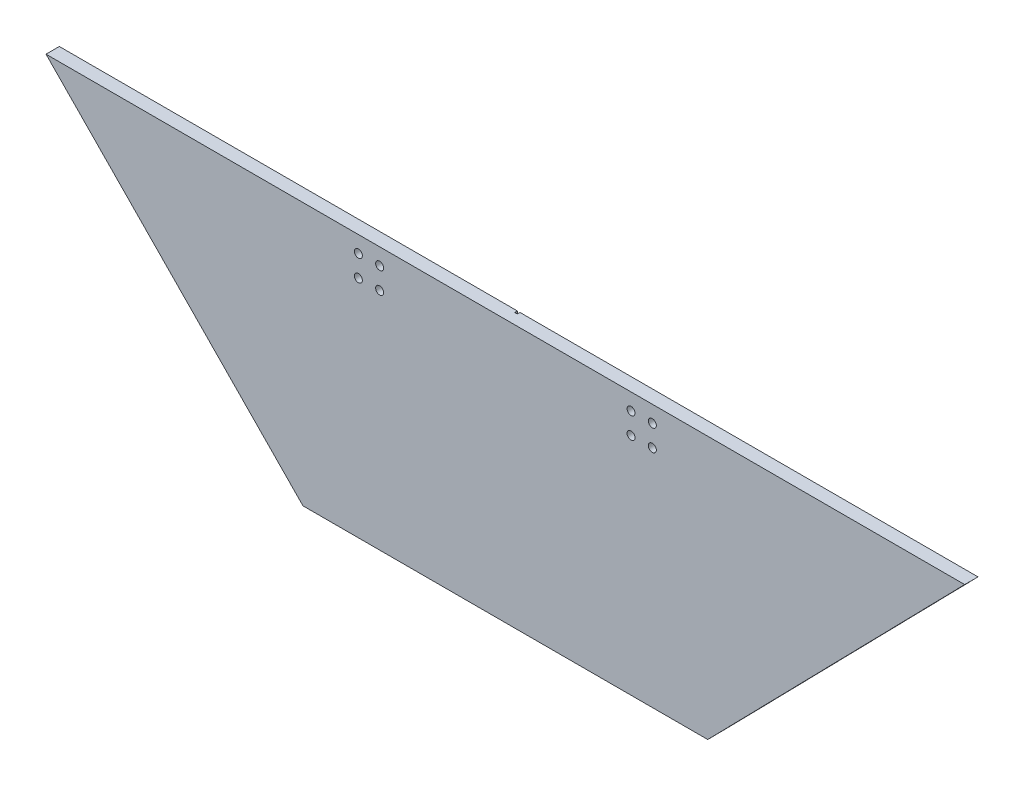
from build123d import *

# Parameters (mm, degrees)
EXTRUDE_1_DEPTH     = 5
SKETCH_3_W          = 1
SKETCH_3_H          = 224.141744844
CUT_EXTRUDE_2_DEPTH = 1
FILLET_1_R          = 10
SKETCH_7_R          = 1.5
CUT_EXTRUDE_3_DEPTH = 10


with BuildPart() as part:
    # 草图1 → 凸台-拉伸1 (new body)
    with BuildSketch(Plane.XY):
        Polygon((-172.5, 0), (172.5, 0), (76, -98.649632539), (-76, -98.649632539), align=None)
    extrude(amount=EXTRUDE_1_DEPTH)

    # 草图3 → 切除-拉伸2 (cut)
    with BuildSketch(Plane(origin=(0, 0, 0), x_dir=(-1, 0, 0), z_dir=(0, 0, -1))):
        with Locations((0, -49.835742657)):
            Rectangle(SKETCH_3_W, SKETCH_3_H)
    extrude(amount=-CUT_EXTRUDE_2_DEPTH, mode=Mode.SUBTRACT)

    # 圆角1
    # the kernel refuses this fillet: 10 mm, written as the material it takes off along each edge
    with BuildSketch(Plane(origin=(97.650635095, -98.649632539, 0), x_dir=(0, 1, 0), z_dir=(-1, 0, 0)), Plane(origin=(21.150635095, -98.649632539, 0), x_dir=(0, 1, 0), z_dir=(-1, 0, 0))) as fillet_1_piece_1:
        with BuildLine():
            CenterArc((8.660254038, -10), FILLET_1_R, 90, 60)
            Line((0, -5), (0, 0))
            Line((0, 0), (8.660254038, 0))
        make_face()
    extrude(amount=118.801270189, mode=Mode.SUBTRACT)

    # 草图7 → 切除-拉伸3 (cut)
    with BuildSketch(Plane(origin=(0, 0, 0), x_dir=(-1, 0, 0), z_dir=(0, 0, -1))):
        with Locations((55.2, -14.174704167)):
            Circle(SKETCH_7_R)
        with Locations((47.2, -14.174704167)):
            Circle(SKETCH_7_R)
        with Locations((47.2, -6.174704167)):
            Circle(SKETCH_7_R)
        with Locations((55.2, -6.174704167)):
            Circle(SKETCH_7_R)
        with Locations((-55.2, -6.174704167)):
            Circle(SKETCH_7_R)
        with Locations((-55.2, -14.174704167)):
            Circle(SKETCH_7_R)
        with Locations((-47.2, -14.174704167)):
            Circle(SKETCH_7_R)
        with Locations((-47.2, -6.174704167)):
            Circle(SKETCH_7_R)
    extrude(amount=-CUT_EXTRUDE_3_DEPTH, mode=Mode.SUBTRACT)


solid = part.part
